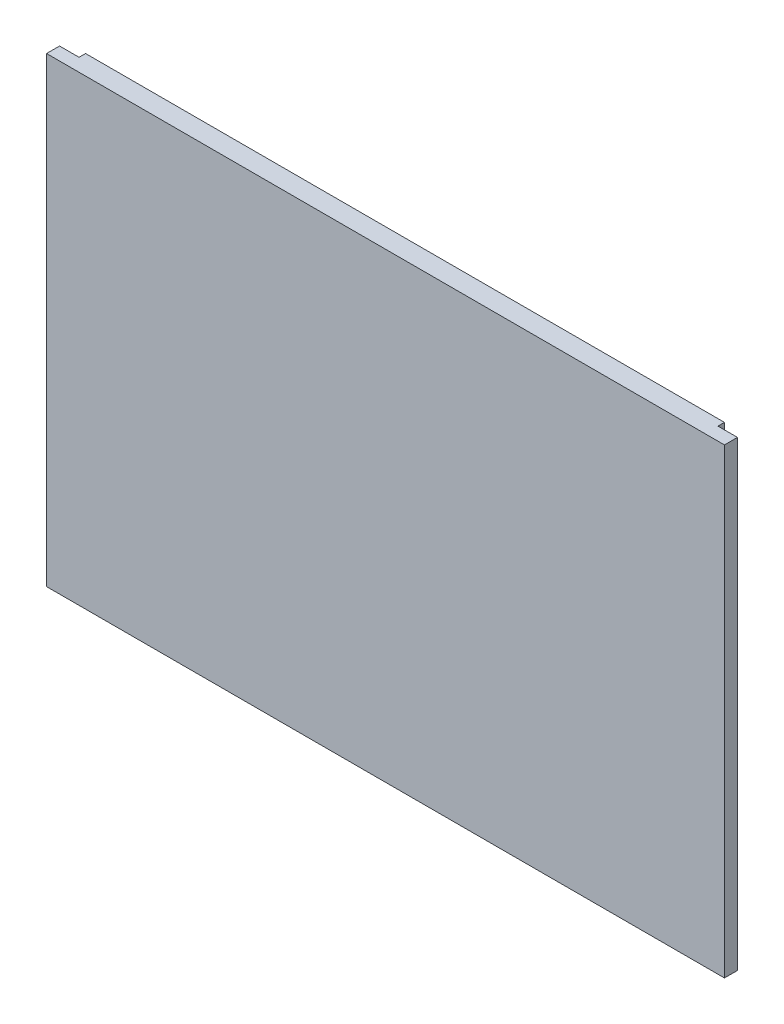
from build123d import *

# Parameters (mm, degrees)
SKETCH5_W                    = 417
SKETCH5_H                    = 284
PANEL_PLY_DEPTH              = 12
SKETCH6_W                    = 12
SKETCH6_H                    = 284
VERTICAL_HOUSING_CUT_DEPTH   = 4
SKETCH7_W                    = 393
SKETCH7_H                    = 12
HORIZONTAL_HOUSING_CUT_DEPTH = 4


with BuildPart() as part:
    # Sketch5 → Panel Ply (new body)
    with BuildSketch(Plane.XY):
        with Locations((208.5, 142)):
            Rectangle(SKETCH5_W, SKETCH5_H)
    extrude(amount=PANEL_PLY_DEPTH)

    # Sketch6 → Vertical Housing Cut (cut)
    with BuildSketch(Plane(origin=(0, 0, 0), x_dir=(-1, 0, 0), z_dir=(0, 0, -1))):
        with Locations((-411, 142)):
            Rectangle(SKETCH6_W, SKETCH6_H)
        with Locations((-6, 142)):
            Rectangle(SKETCH6_W, SKETCH6_H)
    extrude(amount=-VERTICAL_HOUSING_CUT_DEPTH, mode=Mode.SUBTRACT)

    # Sketch7 → Horizontal Housing Cut (cut)
    with BuildSketch(Plane(origin=(0, 0, 0), x_dir=(-1, 0, 0), z_dir=(0, 0, -1))):
        with Locations((-208.5, 142)):
            Rectangle(SKETCH7_W, SKETCH7_H)
    extrude(amount=-HORIZONTAL_HOUSING_CUT_DEPTH, mode=Mode.SUBTRACT)


solid = part.part
